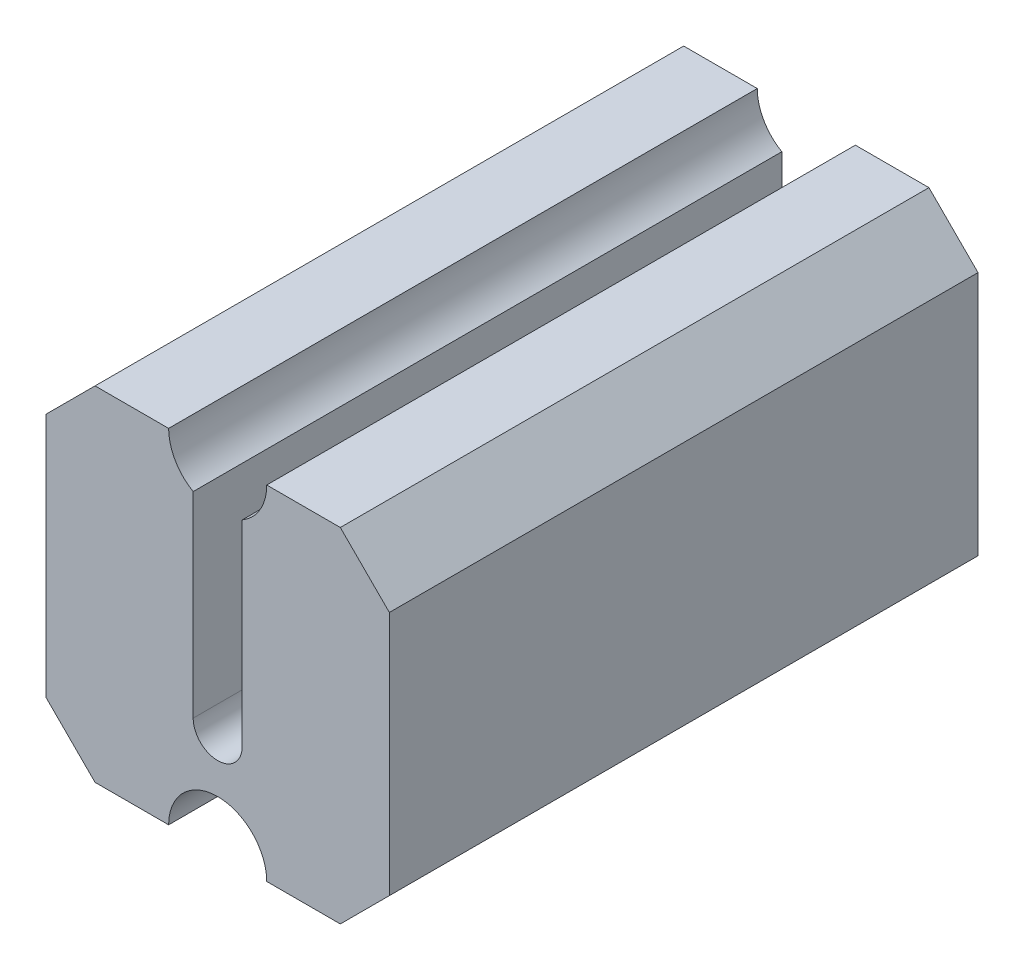
from build123d import *

# Parameters (mm, degrees)
BOSS_EXTRUDE1_DEPTH      = 400
BOSS_EXTRUDE1_DEPTH_BACK = 200


with BuildPart() as part:
    # Sketch1 → Boss-Extrude1 (new, two sides: drawn at the far end of the back side and taken through both)
    with BuildSketch(Plane.XY.offset(-BOSS_EXTRUDE1_DEPTH_BACK)):
        with BuildLine():
            Line((125, 175), (50, 175))
            ThreePointArc((50, 175), (43.301270189, 150), (25, 131.698729811))
            Line((25, 131.698729811), (25, -68.301270189))
            ThreePointArc((25, -68.301270189), (0, -93.301270189), (-25, -68.301270189))
            Line((-25, -68.301270189), (-25, 131.698729811))
            ThreePointArc((-25, 131.698729811), (-43.301270189, 150), (-50, 175))
            Line((-50, 175), (-125, 175))
            Line((-125, 175), (-175, 125))
            Line((-175, 125), (-175, -125))
            Line((-175, -125), (-125, -175))
            Line((-125, -175), (-50, -175))
            ThreePointArc((-50, -175), (0, -125), (50, -175))
            Line((50, -175), (125, -175))
            Line((125, -175), (175, -125))
            Line((175, -125), (175, 125))
            Line((175, 125), (125, 175))
        make_face()
    extrude(amount=BOSS_EXTRUDE1_DEPTH + BOSS_EXTRUDE1_DEPTH_BACK)


solid = part.part
